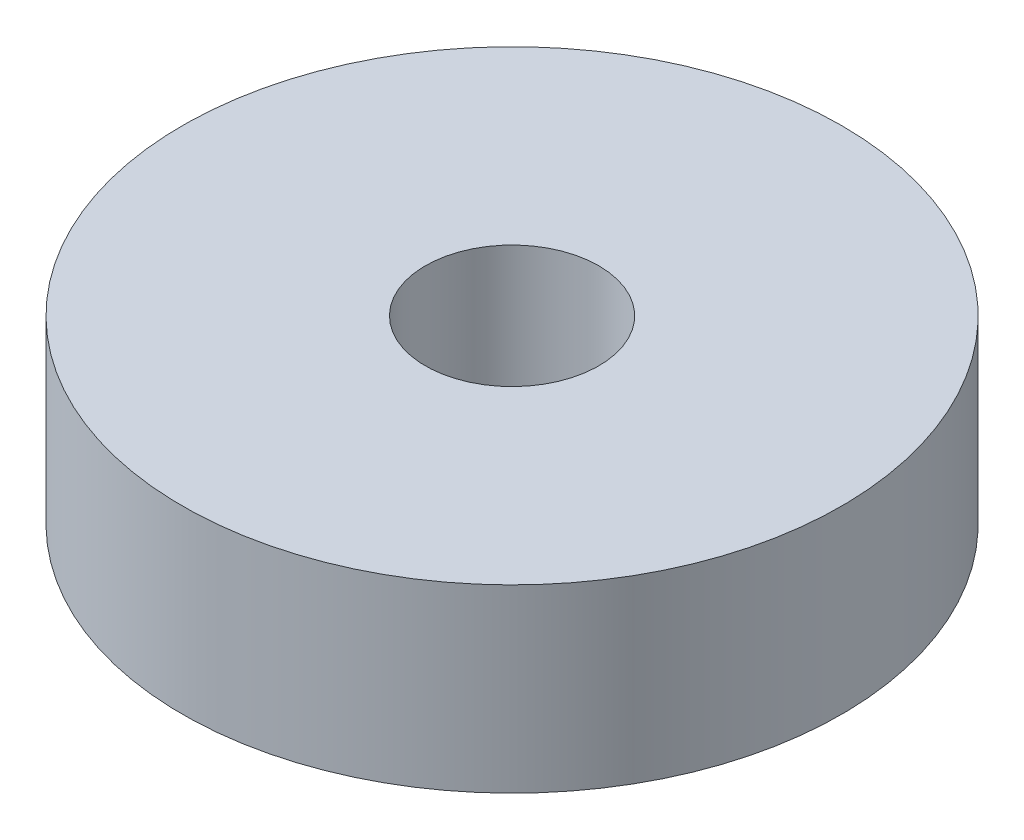
from build123d import *

# Parameters (mm, degrees)
SKETCH1_R           = 47.5
BOSS_EXTRUDE1_DEPTH = 26
SKETCH2_R           = 12.5
CUT_EXTRUDE1_DEPTH  = 73.031243221


with BuildPart() as part:
    # Sketch1 → Boss-Extrude1 (new body)
    with BuildSketch(Plane(origin=(0, 0, 0), x_dir=(1, 0, 0), z_dir=(0, 1, 0))):
        Circle(SKETCH1_R)
    extrude(amount=BOSS_EXTRUDE1_DEPTH)

    # Sketch2 → Cut-Extrude1 (cut, through all)
    with BuildSketch(Plane(origin=(0, 0, 0), x_dir=(1, 0, 0), z_dir=(0, 1, 0))):
        Circle(SKETCH2_R)
    extrude(amount=CUT_EXTRUDE1_DEPTH, mode=Mode.SUBTRACT)


solid = part.part
